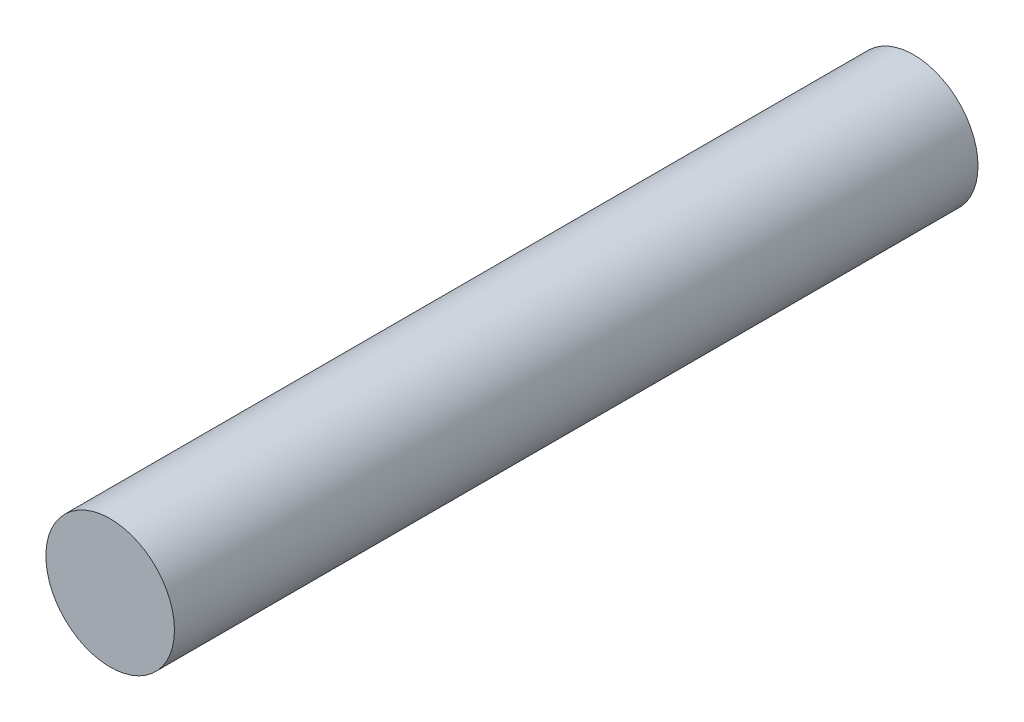
from build123d import *

# Parameters (mm, degrees)
SKETCH2_R           = 1.016
BOSS_EXTRUDE1_DEPTH = 6.35


with BuildPart() as part:
    # Sketch2 → Boss-Extrude1 (new, symmetric)
    with BuildSketch(Plane.XY):
        Circle(SKETCH2_R)
    extrude(amount=BOSS_EXTRUDE1_DEPTH, both=True)


solid = part.part
